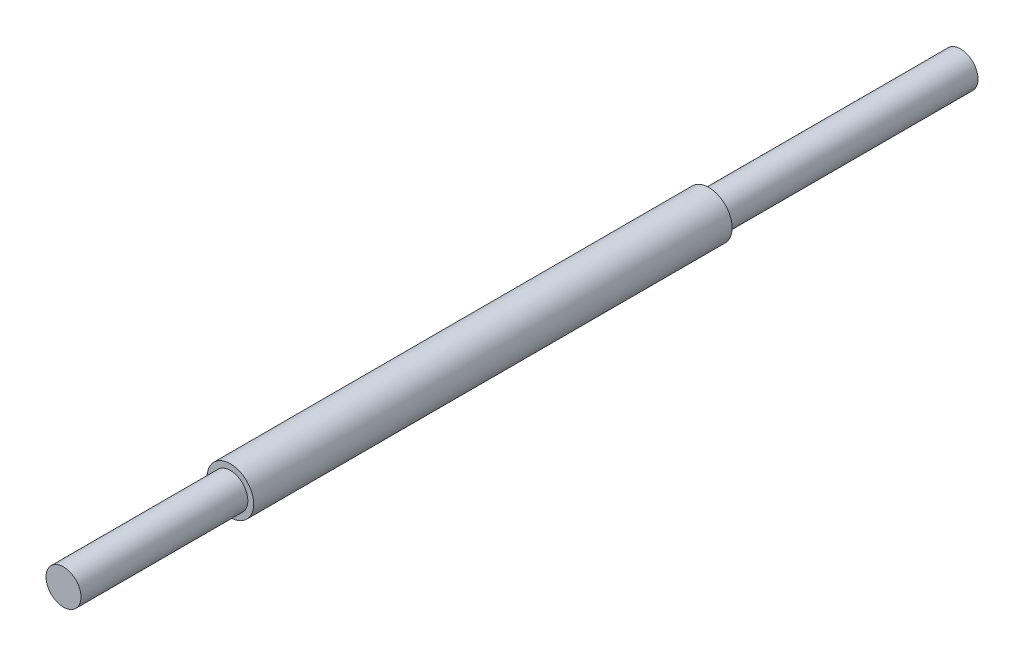
from build123d import *

# Parameters (mm, degrees)
SKETCH1_R           = 6.35
BOSS_EXTRUDE1_DEPTH = 130.3528
SKETCH2_R           = 4.7625
BOSS_EXTRUDE2_DEPTH = 45.466
BOSS_EXTRUDE3_START = 68.58
SKETCH3_R           = 4.7625
BOSS_EXTRUDE3_DEPTH = 68.58


with BuildPart() as part:
    # Sketch1 → Boss-Extrude1 (new body)
    with BuildSketch(Plane.XY):
        Circle(SKETCH1_R)
    extrude(amount=BOSS_EXTRUDE1_DEPTH)

    # Sketch2 → Boss-Extrude2 (add)
    with BuildSketch(Plane.XY.offset(130.3528)):
        Circle(SKETCH2_R)
    extrude(amount=BOSS_EXTRUDE2_DEPTH)

    # Sketch3 → Boss-Extrude3 (add)
    with BuildSketch(Plane(origin=(0, 0, 0), x_dir=(-1, 0, 0), z_dir=(0, 0, -1)).offset(BOSS_EXTRUDE3_START)):
        Circle(SKETCH3_R)
    extrude(amount=-BOSS_EXTRUDE3_DEPTH)


solid = part.part
